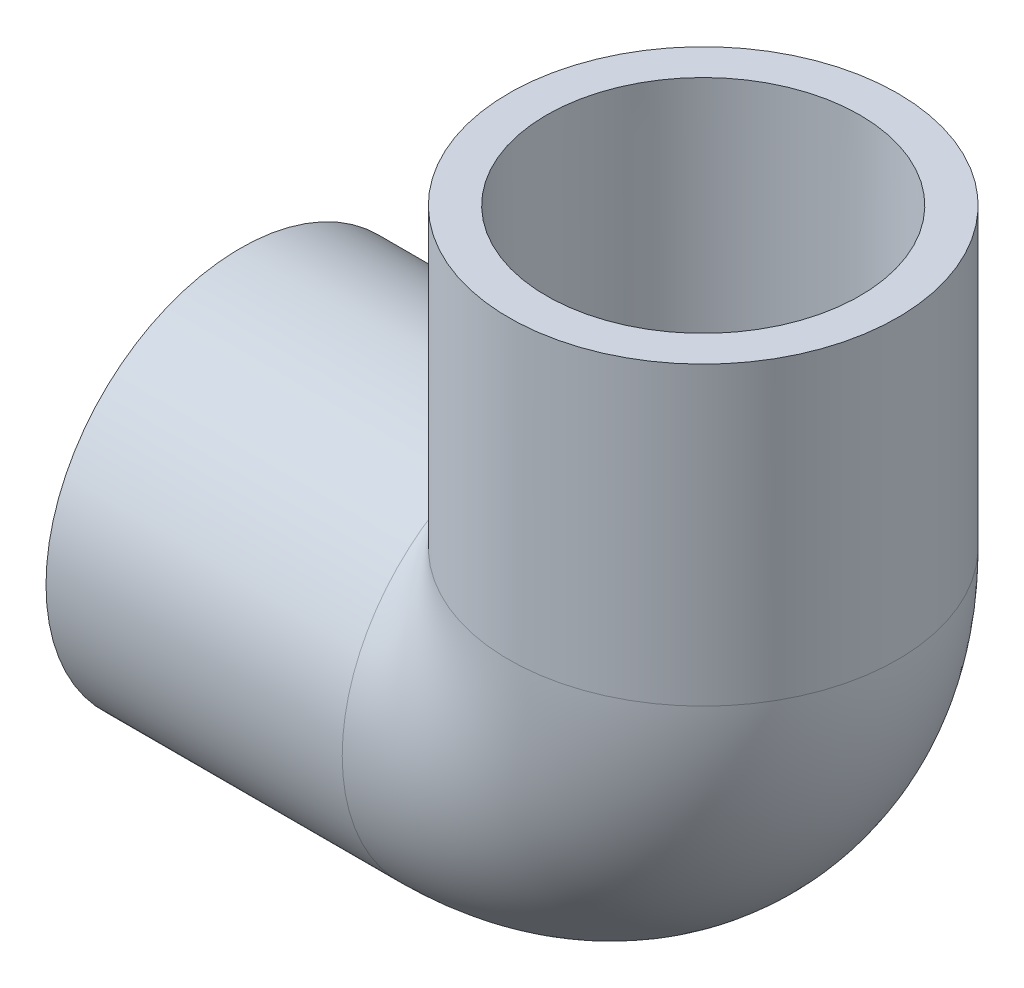
from build123d import *

# Parameters (mm, degrees)
SKETCH3_R   = 16.66875
SKETCH3_R_2 = 10.4648


with BuildPart() as part:
    # Sketch1 → Revolve1 (revolve)
    with BuildSketch(Plane.XY):
        Polygon((-39.6875, -16.66875), (-14.2875, -16.66875), (-14.2875, -13.2842), (-39.6875, -13.4366), align=None)
    revolve(axis=Axis((-39.6875, 0, 0), (1, 0, 0)))


with BuildPart() as body_2:
    # Sketch2 → Revolve2 (revolve)
    with BuildSketch(Plane.XY):
        Polygon((13.4366, 39.6875), (13.2842, 14.2875), (16.66875, 14.2875), (16.66875, 39.6875), align=None)
    revolve(axis=Axis((0, 0, 0), (0, 1, 0)))


with BuildPart() as sweep1_tool:
    # Sweep1: sweep along a path in Sketch4
    with BuildLine(Plane.XY) as sweep1_path:
        ThreePointArc((-14.2875, 0), (-4.184712, 4.184712), (0, 14.2875))
    # Sketch3 → Sweep1 (sweep)
    with BuildSketch(Plane(origin=(-14.2875, 0, 0), x_dir=(0, 0, -1), z_dir=(1, 0, 0))):
        Circle(SKETCH3_R)
        Circle(SKETCH3_R_2, mode=Mode.SUBTRACT)
    sweep(path=sweep1_path.line)


with BuildPart() as part_1:
    add(part.part)


with BuildPart() as part_2:
    # Sweep1: joined with sweep1_tool
    add(part_1.part.fuse(sweep1_tool.part, body_2.part, tol=0.00001))


solid = part_2.part
